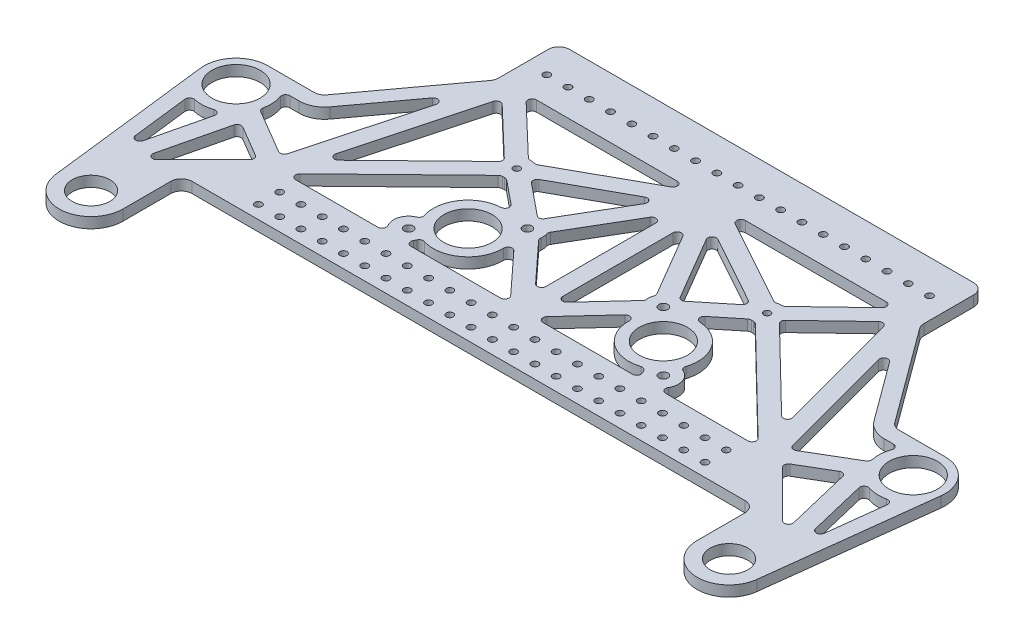
from build123d import *

# Parameters (mm, degrees)
SKETCH1_R            = 1.9939
SKETCH1_R_2          = 11.2395
SKETCH1_R_3          = 14.4145
SKETCH1_R_4          = 2.667
BOSS_EXTRUDE1_DEPTH  = 3.175
SKETCH2_R            = 2.0828
CUT_EXTRUDE1_DEPTH   = 310.212719881
SKETCH7_R            = 2.0828
CUT_EXTRUDE13_DEPTH  = 6.35
FILLET2_R            = 6.35
CUT_EXTRUDE14_START  = -6.35
CUT_EXTRUDE14_DEPTH  = 6.35
FILLET3_R            = 2.54
FILLET4_R            = 2.54
FILLET4_OF_MIRROR1_R = 2.54
FILLET5_START        = -3.175
FILLET5_DEPTH        = 6.35


with BuildPart() as part:
    # Sketch1 → Boss-Extrude1 (new, symmetric)
    with BuildSketch(Plane(origin=(0, 0, 0), x_dir=(1, 0, 0), z_dir=(0, 1, 0))):
        with BuildLine():
            Line((-127, 215.9), (127, 215.9))
            Line((127, 215.9), (127, 177.8))
            Line((127, 177.8), (171.45, 117.354106062))
            Line((171.45, 117.354106062), (202.217651581, 117.354106062))
            ThreePointArc((202.217651581, 117.354106062), (216.462925903, 110.952214992), (221.133744112, 96.049345906))
            Line((221.133744112, 96.049345906), (209.416092531, -2.254760156))
            ThreePointArc((209.416092531, -2.254760156), (189.370633521, -19.016493666), (171.45, 0))
            Line((171.45, 0), (171.45, 34.925))
            Line((171.45, 34.925), (-171.45, 34.925))
            Line((-171.45, 34.925), (-171.45, 0))
            ThreePointArc((-171.45, 0), (-189.370633521, -19.016493666), (-209.416092531, -2.254760156))
            Line((-209.416092531, -2.254760156), (-221.133744112, 96.049345906))
            ThreePointArc((-221.133744112, 96.049345906), (-216.462925903, 110.952214992), (-202.217651581, 117.354106062))
            Line((-202.217651581, 117.354106062), (-171.45, 117.354106062))
            Line((-171.45, 117.354106062), (-127, 177.8))
            Line((-127, 177.8), (-127, 215.9))
        make_face()
        with Locations(Location((-74.76671991, 138.48842, 0), (0, 0, 270))):
            Circle(SKETCH1_R, mode=Mode.SUBTRACT)
        with Locations(Location((-190.5, 0, 0), (0, 0, 270))):
            Circle(SKETCH1_R_2, mode=Mode.SUBTRACT)
        with Locations(Location((74.76671991, 138.48842, 0), (0, 0, 270))):
            Circle(SKETCH1_R, mode=Mode.SUBTRACT)
        with Locations(Location((190.5, 0, 0), (0, 0, 270))):
            Circle(SKETCH1_R_2, mode=Mode.SUBTRACT)
        with Locations(Location((-202.217651581, 98.304106062, 0), (0, 0, 270))):
            Circle(SKETCH1_R_3, mode=Mode.SUBTRACT)
        with Locations(Location((-76.045897469, 75.2348, 0), (0, 0, 270))):
            Circle(SKETCH1_R_4, mode=Mode.SUBTRACT)
        with Locations(Location((-40.587497469, 110.6932, 0), (0, 0, 270))):
            Circle(SKETCH1_R_4, mode=Mode.SUBTRACT)
        with Locations(Location((40.587497469, 110.6932, 0), (0, 0, 270))):
            Circle(SKETCH1_R_4, mode=Mode.SUBTRACT)
        with Locations(Location((76.045897469, 75.2348, 0), (0, 0, 270))):
            Circle(SKETCH1_R_4, mode=Mode.SUBTRACT)
        with Locations(Location((202.217651581, 98.304106062, 0), (0, 0, 270))):
            Circle(SKETCH1_R_3, mode=Mode.SUBTRACT)
        with Locations(Location((-58.316697469, 92.964, 0), (0, 0, 270))):
            Circle(SKETCH1_R_3, mode=Mode.SUBTRACT)
        with Locations(Location((58.316697469, 92.964, 0), (0, 0, 270))):
            Circle(SKETCH1_R_3, mode=Mode.SUBTRACT)
    extrude(amount=BOSS_EXTRUDE1_DEPTH, both=True)

    # Sketch2 → Cut-Extrude1 (cut, through all)
    with BuildSketch(Plane(origin=(0, 3.175, 0), x_dir=(1, 0, 0), z_dir=(0, 1, 0))):
        with Locations(Location((25.4, 195.904866, 0), (0, 0, 270))):
            Circle(SKETCH2_R)
        with Locations(Location((38.1, 195.904866, 0), (0, 0, 270))):
            Circle(SKETCH2_R)
        with Locations(Location((50.8, 195.904866, 0), (0, 0, 270))):
            Circle(SKETCH2_R)
        with Locations(Location((63.5, 195.904866, 0), (0, 0, 270))):
            Circle(SKETCH2_R)
        with Locations(Location((76.2, 195.904866, 0), (0, 0, 270))):
            Circle(SKETCH2_R)
        with Locations(Location((88.9, 195.904866, 0), (0, 0, 270))):
            Circle(SKETCH2_R)
        with Locations(Location((101.6, 195.904866, 0), (0, 0, 270))):
            Circle(SKETCH2_R)
        with Locations(Location((114.3, 195.904866, 0), (0, 0, 270))):
            Circle(SKETCH2_R)
        with Locations(Location((12.7, 195.904866, 0), (0, 0, 270))):
            Circle(SKETCH2_R)
        with Locations(Location((-12.7, 195.904866, 0), (0, 0, 90))):
            Circle(SKETCH2_R)
        with Locations(Location((-114.3, 195.904866, 0), (0, 0, 90))):
            Circle(SKETCH2_R)
        with Locations(Location((-101.6, 195.904866, 0), (0, 0, 90))):
            Circle(SKETCH2_R)
        with Locations(Location((-88.9, 195.904866, 0), (0, 0, 90))):
            Circle(SKETCH2_R)
        with Locations(Location((-76.2, 195.904866, 0), (0, 0, 90))):
            Circle(SKETCH2_R)
        with Locations(Location((-63.5, 195.904866, 0), (0, 0, 90))):
            Circle(SKETCH2_R)
        with Locations(Location((-50.8, 195.904866, 0), (0, 0, 90))):
            Circle(SKETCH2_R)
        with Locations(Location((-38.1, 195.904866, 0), (0, 0, 90))):
            Circle(SKETCH2_R)
        with Locations(Location((-25.4, 195.904866, 0), (0, 0, 90))):
            Circle(SKETCH2_R)
        with Locations(Location((0, 195.904866, 0), (0, 0, 270))):
            Circle(SKETCH2_R)
    extrude(amount=-CUT_EXTRUDE1_DEPTH, mode=Mode.SUBTRACT)

    # Sketch7 → Cut-Extrude13 (cut)
    with BuildSketch(Plane.XZ.offset(3.175)):
        with Locations(Location((133.35, -42.799, 0), (0, 0, 270))):
            Circle(SKETCH7_R)
        with Locations(Location((-95.25, -55.499, 0), (0, 0, 270))):
            Circle(SKETCH7_R)
        with Locations(Location((-107.95, -42.799, 0), (0, 0, 270))):
            Circle(SKETCH7_R)
        with Locations(Location((-107.95, -55.499, 0), (0, 0, 270))):
            Circle(SKETCH7_R)
        with Locations(Location((-120.65, -42.799, 0), (0, 0, 270))):
            Circle(SKETCH7_R)
        with Locations(Location((-69.85, -55.499, 0), (0, 0, 270))):
            Circle(SKETCH7_R)
        with Locations(Location((-82.55, -42.799, 0), (0, 0, 270))):
            Circle(SKETCH7_R)
        with Locations(Location((-82.55, -55.499, 0), (0, 0, 270))):
            Circle(SKETCH7_R)
        with Locations(Location((-95.25, -42.799, 0), (0, 0, 270))):
            Circle(SKETCH7_R)
        with Locations(Location((-120.65, -55.499, 0), (0, 0, 270))):
            Circle(SKETCH7_R)
        with Locations(Location((-133.35, -42.799, 0), (0, 0, 270))):
            Circle(SKETCH7_R)
        with Locations(Location((-133.35, -55.499, 0), (0, 0, 270))):
            Circle(SKETCH7_R)
        with Locations(Location((57.15, -42.799, 0), (0, 0, 270))):
            Circle(SKETCH7_R)
        with Locations(Location((69.85, -55.499, 0), (0, 0, 270))):
            Circle(SKETCH7_R)
        with Locations(Location((69.85, -42.799, 0), (0, 0, 270))):
            Circle(SKETCH7_R)
        with Locations(Location((82.55, -55.499, 0), (0, 0, 270))):
            Circle(SKETCH7_R)
        with Locations(Location((31.75, -42.799, 0), (0, 0, 270))):
            Circle(SKETCH7_R)
        with Locations(Location((44.45, -55.499, 0), (0, 0, 270))):
            Circle(SKETCH7_R)
        with Locations(Location((44.45, -42.799, 0), (0, 0, 270))):
            Circle(SKETCH7_R)
        with Locations(Location((57.15, -55.499, 0), (0, 0, 270))):
            Circle(SKETCH7_R)
        with Locations(Location((107.95, -42.799, 0), (0, 0, 270))):
            Circle(SKETCH7_R)
        with Locations(Location((120.65, -55.499, 0), (0, 0, 270))):
            Circle(SKETCH7_R)
        with Locations(Location((120.65, -42.799, 0), (0, 0, 270))):
            Circle(SKETCH7_R)
        with Locations(Location((133.35, -55.499, 0), (0, 0, 270))):
            Circle(SKETCH7_R)
        with Locations(Location((82.55, -42.799, 0), (0, 0, 270))):
            Circle(SKETCH7_R)
        with Locations(Location((95.25, -55.499, 0), (0, 0, 270))):
            Circle(SKETCH7_R)
        with Locations(Location((95.25, -42.799, 0), (0, 0, 270))):
            Circle(SKETCH7_R)
        with Locations(Location((107.95, -55.499, 0), (0, 0, 270))):
            Circle(SKETCH7_R)
        with Locations(Location((-44.45, -42.799, 0), (0, 0, 270))):
            Circle(SKETCH7_R)
        with Locations(Location((-31.75, -55.499, 0), (0, 0, 270))):
            Circle(SKETCH7_R)
        with Locations(Location((-31.75, -42.799, 0), (0, 0, 270))):
            Circle(SKETCH7_R)
        with Locations(Location((-19.05, -55.499, 0), (0, 0, 270))):
            Circle(SKETCH7_R)
        with Locations(Location((-69.85, -42.799, 0), (0, 0, 270))):
            Circle(SKETCH7_R)
        with Locations(Location((-57.15, -55.499, 0), (0, 0, 270))):
            Circle(SKETCH7_R)
        with Locations(Location((-57.15, -42.799, 0), (0, 0, 270))):
            Circle(SKETCH7_R)
        with Locations(Location((-44.45, -55.499, 0), (0, 0, 270))):
            Circle(SKETCH7_R)
        with Locations(Location((6.35, -42.799, 0), (0, 0, 270))):
            Circle(SKETCH7_R)
        with Locations(Location((19.05, -55.499, 0), (0, 0, 270))):
            Circle(SKETCH7_R)
        with Locations(Location((19.05, -42.799, 0), (0, 0, 270))):
            Circle(SKETCH7_R)
        with Locations(Location((31.75, -55.499, 0), (0, 0, 270))):
            Circle(SKETCH7_R)
        with Locations(Location((-19.05, -42.799, 0), (0, 0, 270))):
            Circle(SKETCH7_R)
        with Locations(Location((-6.35, -55.499, 0), (0, 0, 270))):
            Circle(SKETCH7_R)
        with Locations(Location((-6.35, -42.799, 0), (0, 0, 270))):
            Circle(SKETCH7_R)
        with Locations(Location((6.35, -55.499, 0), (0, 0, 270))):
            Circle(SKETCH7_R)
    extrude(amount=-CUT_EXTRUDE13_DEPTH, mode=Mode.SUBTRACT)

    # Fillet2
    fillet2_edges = [part.edges().sort_by_distance(p)[0] for p in [
        (171.45, 0, -34.925),
        (-171.45, 0, -34.925),
        (-171.45, 0, -117.354106062),
        (-127, 0, -177.8),
        (-127, 0, -215.9),
        (127, 0, -215.9),
        (127, 0, -177.8),
        (171.45, 0, -117.354106062),
    ]]
    fillet(fillet2_edges, radius=FILLET2_R)

    # Cut-Extrude14: read off the stored shape, not the designer's step
    # Cut-Extrude14 outline → Cut-Extrude14 (cut)
    with BuildSketch(Plane(origin=(0, 3.175, 0), x_dir=(1, 0, 0), z_dir=(0, 1, 0)).offset(CUT_EXTRUDE14_START)):
        with BuildLine():
            ThreePointArc((-191.259096018, 80.666801273), (-200.5240125, 77.60879145), (-210.162841238, 79.119778564))
            Line((-210.162841238, 79.119778564), (-204.019934013, 27.584451775))
            Line((-204.019934013, 27.584451775), (-191.259096018, 80.666801273))
        make_face()
        with BuildLine():
            ThreePointArc((-184.108569323, 108.464106062), (-181.585424546, 100.644120554), (-182.293194572, 92.457699206))
            Line((-182.293194572, 92.457699206), (-151.72468264, 74.441225873))
            Line((-151.72468264, 74.441225873), (-128.52280805, 160.723179985))
            Line((-128.52280805, 160.723179985), (-162.384828565, 114.675483683))
            ThreePointArc((-162.384828565, 114.675483683), (-167.782783829, 110.105322935), (-174.662514745, 108.464106062))
            Line((-174.662514745, 108.464106062), (-184.108569323, 108.464106062))
        make_face()
        with BuildLine():
            ThreePointArc((-39.272123059, 101.772657463), (-39.385427432, 101.756684089), (-39.498925379, 101.742149793))
            ThreePointArc((-39.498925379, 101.742149793), (-43.633978712, 78.281281241), (-67.094847263, 74.146227909))
            ThreePointArc((-67.094847263, 74.146227909), (-69.068691676, 69.522979946), (-73.211093603, 66.675))
            Line((-73.211093603, 66.675), (-6.909916439, 66.675))
            Line((-6.909916439, 66.675), (-39.272123059, 101.772657463))
        make_face()
        with BuildLine():
            ThreePointArc((-32.43632141, 114.548665971), (-31.6222383, 111.657781272), (-31.802741851, 108.659887992))
            Line((-31.802741851, 108.659887992), (-5.08, 79.678377215))
            Line((-5.08, 79.678377215), (-5.08, 161.183488616))
            Line((-5.08, 161.183488616), (-32.43632141, 114.548665971))
        make_face()
        with BuildLine():
            ThreePointArc((-43.162255097, 119.33478042), (-42.190861956, 119.566503293), (-41.199802002, 119.689386534))
            Line((-41.199802002, 119.689386534), (-13.766953585, 166.454666172))
            Line((-13.766953585, 166.454666172), (-65.728320974, 137.68595171))
            Line((-65.728320974, 137.68595171), (-43.162255097, 119.33478042))
        make_face()
        with BuildLine():
            Line((-75.96708436, 130.23131443), (-141.26907846, 66.675))
            Line((-141.26907846, 66.675), (-78.880701336, 66.675))
            ThreePointArc((-78.880701336, 66.675), (-85.018393692, 76.129562837), (-77.13446956, 84.185850207))
            ThreePointArc((-77.13446956, 84.185850207), (-73.36056899, 107.276455761), (-50.486550734, 112.19556942))
            Line((-50.486550734, 112.19556942), (-72.836367838, 130.37088293))
            ThreePointArc((-72.836367838, 130.37088293), (-74.395114846, 130.152799034), (-75.96708436, 130.23131443))
        make_face()
        with BuildLine():
            ThreePointArc((-76.044983874, 146.733825293), (-73.698448589, 146.763651936), (-71.436415448, 146.138893149))
            Line((-71.436415448, 146.138893149), (-10.487798064, 179.883451048))
            Line((-10.487798064, 179.883451048), (-110.754790282, 179.883451048))
            Line((-110.754790282, 179.883451048), (-76.044983874, 146.733825293))
        make_face()
        with BuildLine():
            ThreePointArc((-83.053312583, 137.512177673), (-83.110526949, 138.449033356), (-83.062159723, 139.386387434))
            Line((-83.062159723, 139.386387434), (-115.427439153, 170.296870998))
            Line((-115.427439153, 170.296870998), (-138.845326815, 83.211618432))
            Line((-138.845326815, 83.211618432), (-83.053312583, 137.512177673))
        make_face()
        Polygon((-156.782789951, 65.629029636), (-180.994268973, 79.898794128), (-193.153773173, 29.317864259), (-179.464477122, 42.947342466), align=None)
    cut_extrude14 = extrude(amount=CUT_EXTRUDE14_DEPTH, mode=Mode.SUBTRACT)

    # Fillet3
    # the kernel refuses this fillet: 2.54 mm, written as the material it adds along each edge
    with BuildSketch(Plane(origin=(-39.498925379, -3.175, -101.742149793), x_dir=(0.2258482453894221, 0, 0.9741624967399019), z_dir=(0, 1, 0))) as fillet3_piece_1:
        with BuildLine():
            CenterArc((9.128930143, 2.484904902), FILLET3_R, 119.625204819, 138.419359248)
            Line((7.873346381, 4.692869896), (7.747788004, 4.913666396))
            ThreePointArc((7.747788004, 4.913666396), (-0.104054898, 0.448628917), (-0.252552944, 0.027074166))
            Line((-0.252552944, 0.027074166), (0.052616312, -0.24849049))
            ThreePointArc((0.052616312, -0.24849049), (4.301383511, 0.196402429), (8.55015071, -0.24849049))
            Line((8.55015071, -0.24849049), (8.602767022, 0))
        make_face()
    extrude(amount=6.35)

    # Fillet4
    # the kernel refuses this fillet: 2.54 mm, written as the material it adds along each edge
    with BuildSketch(Plane(origin=(-83.062159723, -3.175, -139.386387434), x_dir=(-0.04732152733120442, 0, 0.9988797089995582), z_dir=(0, 1, 0))) as fillet4_piece_1:
        with BuildLine():
            CenterArc((1.162366176, -2.53535455), FILLET4_R, 93.4657791, 45.563633514)
            Line((-0.755451341, -0.869948903), (0, 0))
            ThreePointArc((0, 0), (0.504408571, -0.015260303), (1.008817143, 0))
        make_face()
    extrude(amount=6.35)
    with BuildSketch(Plane(origin=(-83.053312583, -3.175, -137.512177673), x_dir=(-0.7166203979765482, 0, 0.6974634077884899), z_dir=(0, 1, 0))) as fillet4_piece_2:
        with BuildLine():
            CenterArc((1.152179596, -2.54), FILLET4_R, 90, 45.563633498)
            ThreePointArc((-0.661452664, -0.761703617), (-0.319204097, -0.390857555), (0, 0))
            Line((0, 0), (1.152179596, 0))
        make_face()
    extrude(amount=6.35)
    with BuildSketch(Plane(origin=(-138.845326815, -3.175, -83.211618432), x_dir=(0.7166203979765504, 0, -0.697463407788488), z_dir=(0, 1, 0))) as fillet4_piece_3:
        with BuildLine():
            CenterArc((FILLET4_R * 3.63978872933, FILLET4_R), FILLET4_R, 120.724931699, 149.275068301)
            Line((FILLET4_R * 3.12887170345, FILLET4_R * 1.85963003243), (0, 0))
            Line((0, 0), (FILLET4_R * 3.63978872933, 0))
        make_face()
    extrude(amount=6.35)
    with BuildSketch(Plane(origin=(-115.427439153, -3.175, -170.296870998), x_dir=(-0.25968248598533045, 0, 0.9656940542803806), z_dir=(0, 1, 0))) as fillet4_piece_4:
        with BuildLine():
            CenterArc((FILLET4_R * 1.68525379622, FILLET4_R), FILLET4_R, 151.368298701, 118.631701299)
            Line((FILLET4_R * 0.807535811571, FILLET4_R * 1.47917756565), (0, 0))
            Line((0, 0), (FILLET4_R * 1.68525379622, 0))
        make_face()
    extrude(amount=6.35)
    with BuildSketch(Plane(origin=(-77.13446956, -3.175, -84.185850207), x_dir=(-0.3638938882978765, 0, -0.9314404103642124), z_dir=(0, 1, 0))) as fillet4_piece_5:
        with BuildLine():
            CenterArc((2.81982852, 2.534794914), FILLET4_R, 181.445326083, 84.886001486)
            ThreePointArc((0.280636623, 2.470728433), (0.225896023, 1.225643909), (0, 0))
            ThreePointArc((0, 0), (1.32865119, 0.042551581), (2.65730238, 0))
        make_face()
    extrude(amount=6.35)
    with BuildSketch(Plane(origin=(-78.880701336, -3.175, -66.675), x_dir=(-1, 0, 0), z_dir=(0, 1, 0))) as fillet4_piece_6:
        with BuildLine():
            CenterArc((7.030603219, -2.54), FILLET4_R, 90, 121.391239679)
            ThreePointArc((4.862381881, -3.863032967), (2.7742475, -1.499712765), (0, 0))
            Line((0, 0), (7.030603219, 0))
        make_face()
    extrude(amount=6.35)
    with BuildSketch(Plane(origin=(-141.26907846, -3.175, -66.675), x_dir=(0.716620397973644, 0, -0.6974634077914742), z_dir=(0, 1, 0))) as fillet4_piece_7:
        with BuildLine():
            CenterArc((FILLET4_R * 2.46123363433, -FILLET4_R), FILLET4_R, 90, 135.776154525)
            Line((FILLET4_R * 1.76377022654, -FILLET4_R * 1.71662039797), (0, 0))
            Line((0, 0), (FILLET4_R * 2.46123363433, 0))
        make_face()
    extrude(amount=6.35)
    with BuildSketch(Plane(origin=(-75.96708436, -3.175, -130.23131443), x_dir=(0.9964847240110659, 0, 0.08377466689035494), z_dir=(0, 1, 0))) as fillet4_piece_8:
        with BuildLine():
            CenterArc((1.162366176, -2.53535455), FILLET4_R, 93.465779089, 45.563633514)
            Line((-0.755451341, -0.869948902), (0, 0))
            ThreePointArc((0, 0), (0.504408572, -0.015260303), (1.008817143, 0))
        make_face()
    extrude(amount=6.35)
    with BuildSketch(Plane(origin=(-72.836367838, -3.175, -130.37088293), x_dir=(-0.985077138170045, 0, 0.17211342729349766), z_dir=(0, 1, 0))) as fillet4_piece_9:
        with BuildLine():
            CenterArc((1.162366176, 2.53535455), FILLET4_R, 220.970587389, 45.563633522)
            Line((-0.755451341, 0.869948903), (0, 0))
            ThreePointArc((0, 0), (0.504408572, 0.015260303), (1.008817143, 0))
        make_face()
    extrude(amount=6.35)
    with BuildSketch(Plane(origin=(-50.486550734, -3.175, -112.19556942), x_dir=(-0.7758406200304794, 0, -0.630928943947511), z_dir=(0, 1, 0))) as fillet4_piece_10:
        with BuildLine():
            CenterArc((9.532413351, 2.54), FILLET4_R, 131.991620614, 138.008379386)
            ThreePointArc((7.833097685, 4.427836398), (4.159272934, 1.784525297), (0, 0))
            Line((0, 0), (9.532413351, 0))
        make_face()
    extrude(amount=6.35)
    with BuildSketch(Plane(origin=(-180.994268973, -3.175, -79.898794128), x_dir=(0.8615028843672974, 0, 0.5077526762379762), z_dir=(0, 1, 0))) as fillet4_piece_11:
        with BuildLine():
            CenterArc((FILLET4_R * 1.35134876474, -FILLET4_R), FILLET4_R, 90, 106.99701288)
            Line((FILLET4_R * 0.395028767259, -FILLET4_R * 1.2923218473), (0, 0))
            Line((0, 0), (FILLET4_R * 1.35134876474, 0))
        make_face()
    extrude(amount=6.35)
    with BuildSketch(Plane(origin=(-156.782789951, -3.175, -65.629029636), x_dir=(-0.707106781202138, 0, 0.707106781170957), z_dir=(0, 1, 0))) as fillet4_piece_12:
        with BuildLine():
            CenterArc((FILLET4_R * 1.29118611705, -FILLET4_R), FILLET4_R, 90, 104.485747761)
            Line((FILLET4_R * 0.322976224971, -FILLET4_R * 1.25013917104), (0, 0))
            Line((0, 0), (FILLET4_R * 1.29118611705, 0))
        make_face()
    extrude(amount=6.35)
    with BuildSketch(Plane(origin=(-193.153773173, -3.175, -29.317864259), x_dir=(0.7086533803705231, 0, -0.705556791824323), z_dir=(0, 1, 0))) as fillet4_piece_13:
        with BuildLine():
            CenterArc((FILLET4_R * 3.53295813786, FILLET4_R), FILLET4_R, 121.608216653, 148.391783347)
            Line((FILLET4_R * 3.00885009312, FILLET4_R * 1.8516517818), (0, 0))
            Line((0, 0), (FILLET4_R * 3.53295813786, 0))
        make_face()
    extrude(amount=6.35)
    with BuildSketch(Plane(origin=(-128.52280805, -3.175, -160.723179985), x_dir=(-0.5924292899367688, 0, 0.8056224527810878), z_dir=(0, 1, 0))) as fillet4_piece_14:
        with BuildLine():
            CenterArc((FILLET4_R * 5.3233163656, FILLET4_R), FILLET4_R, 111.278365334, 158.721634666)
            Line((FILLET4_R * 4.96041696403, FILLET4_R * 1.93182832343), (0, 0))
            Line((0, 0), (FILLET4_R * 5.3233163656, 0))
        make_face()
    extrude(amount=6.35)
    with BuildSketch(Plane(origin=(-151.72468264, -3.175, -74.441225873), x_dir=(0.2596824859879843, 0, -0.9656940542796669), z_dir=(0, 1, 0))) as fillet4_piece_15:
        with BuildLine():
            CenterArc((FILLET4_R * 1.31418654711, FILLET4_R), FILLET4_R, 164.536970586, 105.463029414)
            Line((FILLET4_R * 0.350383856701, FILLET4_R * 1.2666165298), (0, 0))
            Line((0, 0), (FILLET4_R * 1.31418654711, 0))
        make_face()
    extrude(amount=6.35)
    with BuildSketch(Plane(origin=(-182.293194572, -3.175, -92.457699206), x_dir=(0.2400768424975751, 0, -0.9707538872939909), z_dir=(0, 1, 0))) as fillet4_piece_16:
        with BuildLine():
            CenterArc((1.893158688, -2.537655167), FILLET4_R, 92.462125159, 70.914698312)
            Line((-0.540686922, -1.811022148), (0, 0))
            ThreePointArc((0, 0), (0.892021457, -0.019169008), (1.784042914, 0))
        make_face()
    extrude(amount=6.35)
    with BuildSketch(Plane(origin=(-184.108569323, -3.175, -108.464106062), x_dir=(1, 0, 0), z_dir=(0, 1, 0))) as fillet4_piece_17:
        with BuildLine():
            CenterArc((3.914435178, -2.54), FILLET4_R, 90, 109.085301697)
            ThreePointArc((1.514051806, -3.370517711), (0.832146175, -1.65151449), (0, 0))
            Line((0, 0), (3.914435178, 0))
        make_face()
    extrude(amount=6.35)
    with BuildSketch(Plane(origin=(-41.199802002, -3.175, -119.689386534), x_dir=(-0.9917304978287779, 0, 0.12833791207700182), z_dir=(0, 1, 0))) as fillet4_piece_18:
        with BuildLine():
            CenterArc((1.248793481, -2.535316742), FILLET4_R, 93.479858275, 48.750392907)
            Line((-0.759021925, -0.979592701), (0, 0))
            ThreePointArc((0, 0), (0.547310723, -0.016625565), (1.094621445, 0))
        make_face()
    extrude(amount=6.35)
    with BuildSketch(Plane(origin=(-43.162255097, -3.175, -119.33478042), x_dir=(-0.7758406200501416, 0, -0.6309289439233327), z_dir=(0, 1, 0))) as fillet4_piece_19:
        with BuildLine():
            CenterArc((1.239240147, -2.54), FILLET4_R, 90, 48.750392898)
            ThreePointArc((-0.670444448, -0.865274725), (-0.322080072, -0.442820351), (0, 0))
            Line((0, 0), (1.239240147, 0))
        make_face()
    extrude(amount=6.35)
    with BuildSketch(Plane(origin=(-65.728320974, -3.175, -137.68595171), x_dir=(0.7758406200501409, 0, 0.6309289439233334), z_dir=(0, 1, 0))) as fillet4_piece_20:
        with BuildLine():
            CenterArc((FILLET4_R * 1.48005069013, FILLET4_R), FILLET4_R, 158.090054087, 111.909945913)
            Line((FILLET4_R * 0.552279196759, FILLET4_R * 1.37314883905), (0, 0))
            Line((0, 0), (FILLET4_R * 1.48005069013, 0))
        make_face()
    extrude(amount=6.35)
    with BuildSketch(Plane(origin=(-13.766953585, -3.175, -166.454666172), x_dir=(-0.8748619151761108, 0, 0.4843724077343668), z_dir=(0, 1, 0))) as fillet4_piece_21:
        with BuildLine():
            CenterArc((FILLET4_R * 3.65132209502, FILLET4_R), FILLET4_R, 120.632445885, 149.367554115)
            Line((FILLET4_R * 3.14179333344, FILLET4_R * 1.8604536252), (0, 0))
            Line((0, 0), (FILLET4_R * 3.65132209502, 0))
        make_face()
    extrude(amount=6.35)
    with BuildSketch(Plane(origin=(-31.802741851, -3.175, -108.659887992), x_dir=(0.6778770206187044, 0, 0.7351753157697207), z_dir=(0, 1, 0))) as fillet4_piece_22:
        with BuildLine():
            CenterArc((1.239240147, 2.54), FILLET4_R, 221.249607085, 48.750392915)
            ThreePointArc((-0.670444449, 0.865274726), (-0.322080073, 0.442820351), (0, 0))
            Line((0, 0), (1.239240147, 0))
        make_face()
    extrude(amount=6.35)
    with BuildSketch(Plane(origin=(-32.43632141, -3.175, -114.548665971), x_dir=(0.505976433417387, 0, -0.8625473023702646), z_dir=(0, 1, 0))) as fillet4_piece_23:
        with BuildLine():
            CenterArc((1.239240146, -2.54), FILLET4_R, 90, 48.750392908)
            ThreePointArc((-0.670444449, -0.865274725), (-0.322080073, -0.442820351), (0, 0))
            Line((0, 0), (1.239240146, 0))
        make_face()
    extrude(amount=6.35)
    with BuildSketch(Plane(origin=(-5.08, -3.175, -161.183488616), x_dir=(0, 0, 1), z_dir=(0, 1, 0))) as fillet4_piece_24:
        with BuildLine():
            CenterArc((FILLET4_R * 3.6810949668, -FILLET4_R), FILLET4_R, 90, 149.603808338)
            Line((FILLET4_R * 3.17511853338, -FILLET4_R * 1.86254730237), (0, 0))
            Line((0, 0), (FILLET4_R * 3.6810949668, 0))
        make_face()
    extrude(amount=6.35)
    with BuildSketch(Plane(origin=(-5.08, -3.175, -79.678377215), x_dir=(0, 0, -1), z_dir=(0, 1, 0))) as fillet4_piece_25:
        with BuildLine():
            CenterArc((FILLET4_R * 2.5597199241, FILLET4_R), FILLET4_R, 132.677967866, 137.322032134)
            Line((FILLET4_R * 1.88184290348, FILLET4_R * 1.73517531577), (0, 0))
            Line((0, 0), (FILLET4_R * 2.5597199241, 0))
        make_face()
    extrude(amount=6.35)
    with BuildSketch(Plane(origin=(-71.436415448, -3.175, -146.138893149), x_dir=(-0.9393456154245149, 0, -0.3429720320707496), z_dir=(0, 1, 0))) as fillet4_piece_26:
        with BuildLine():
            CenterArc((1.162366175, -2.53535455), FILLET4_R, 93.465779079, 45.5636335)
            Line((-0.755451341, -0.869948902), (0, 0))
            ThreePointArc((0, 0), (0.504408571, -0.015260303), (1.008817143, 0))
        make_face()
    extrude(amount=6.35)
    with BuildSketch(Plane(origin=(-76.044983874, -3.175, -146.733825293), x_dir=(-0.7231730176127877, 0, -0.6906669143638013), z_dir=(0, 1, 0))) as fillet4_piece_27:
        with BuildLine():
            CenterArc((1.152179596, -2.54), FILLET4_R, 90, 45.563633513)
            ThreePointArc((-0.661452665, -0.761703617), (-0.319204098, -0.390857555), (0, 0))
            Line((0, 0), (1.152179596, 0))
        make_face()
    extrude(amount=6.35)
    with BuildSketch(Plane(origin=(-110.754790282, -3.175, -179.883451048), x_dir=(0.7231730176127913, 0, 0.6906669143637977), z_dir=(0, 1, 0))) as fillet4_piece_28:
        with BuildLine():
            CenterArc((FILLET4_R * 2.49494073305, FILLET4_R), FILLET4_R, 133.682924128, 136.317075872)
            Line((FILLET4_R * 1.80427381868, FILLET4_R * 1.72317301761), (0, 0))
            Line((0, 0), (FILLET4_R * 2.49494073305, 0))
        make_face()
    extrude(amount=6.35)
    with BuildSketch(Plane(origin=(-10.487798064, -3.175, -179.883451048), x_dir=(-1, 0, 0), z_dir=(0, 1, 0))) as fillet4_piece_29:
        with BuildLine():
            CenterArc((FILLET4_R * 3.87070337873, FILLET4_R), FILLET4_R, 118.971362453, 151.028637547)
            Line((FILLET4_R * 3.386330971, FILLET4_R * 1.87486191518), (0, 0))
            Line((0, 0), (FILLET4_R * 3.87070337873, 0))
        make_face()
    extrude(amount=6.35)
    with BuildSketch(Plane(origin=(-6.909916439, -3.175, -66.675), x_dir=(-0.6778770206056016, 0, -0.7351753157818024), z_dir=(0, 1, 0))) as fillet4_piece_30:
        with BuildLine():
            CenterArc((FILLET4_R * 2.28228149747, FILLET4_R), FILLET4_R, 137.322032135, 132.677967865)
            Line((FILLET4_R * 1.54710618169, FILLET4_R * 1.67787702061), (0, 0))
            Line((0, 0), (FILLET4_R * 2.28228149747, 0))
        make_face()
    extrude(amount=6.35)
    with BuildSketch(Plane(origin=(-73.211093603, -3.175, -66.675), x_dir=(1, 0, 0), z_dir=(0, 1, 0))) as fillet4_piece_31:
        with BuildLine():
            CenterArc((7.03060322, 2.54), FILLET4_R, 148.608760327, 121.391239673)
            ThreePointArc((4.862381882, 3.863032967), (2.774247501, 1.499712765), (0, 0))
            Line((0, 0), (7.03060322, 0))
        make_face()
    extrude(amount=6.35)
    with BuildSketch(Plane(origin=(-67.094847263, -3.175, -74.146227909), x_dir=(0.9314404103532474, 0, 0.3638938883259433), z_dir=(0, 1, 0))) as fillet4_piece_32:
        with BuildLine():
            CenterArc((2.81982852, -2.534794914), FILLET4_R, 93.668672431, 84.886001494)
            ThreePointArc((0.280636624, -2.470728434), (0.225896023, -1.225643909), (0, 0))
            ThreePointArc((0, 0), (1.32865119, -0.042551581), (2.657302381, 0))
        make_face()
    extrude(amount=6.35)
    with BuildSketch(Plane(origin=(-210.162841238, -3.175, -79.119778564), x_dir=(0.11836011318265625, 0, 0.9929707365312378), z_dir=(0, 1, 0))) as fillet4_piece_33:
        with BuildLine():
            CenterArc((3.914435177, 2.54), FILLET4_R, 160.914698309, 109.085301691)
            ThreePointArc((1.514051805, 3.370517711), (0.832146175, 1.651514489), (0, 0))
            Line((0, 0), (3.914435177, 0))
        make_face()
    extrude(amount=6.35)
    with BuildSketch(Plane(origin=(-191.259096018, -3.175, -80.666801273), x_dir=(-0.23373792345864905, 0, 0.972299636499592), z_dir=(0, 1, 0))) as fillet4_piece_34:
        with BuildLine():
            CenterArc((5.245565583, -2.54), FILLET4_R, 90, 121.675881517)
            ThreePointArc((3.083943719, -3.873788184), (1.657852076, -1.844641225), (0, 0))
            Line((0, 0), (5.245565583, 0))
        make_face()
    extrude(amount=6.35)
    with BuildSketch(Plane(origin=(-204.019934013, -3.175, -27.584451775), x_dir=(0.2337379234586465, 0, -0.9722996364995926), z_dir=(0, 1, 0))) as fillet4_piece_35:
        with BuildLine():
            CenterArc((FILLET4_R * 5.58159991966, FILLET4_R), FILLET4_R, 110.314708853, 159.685291147)
            Line((FILLET4_R * 5.23442350663, FILLET4_R * 1.93779983911), (0, 0))
            Line((0, 0), (FILLET4_R * 5.58159991966, 0))
        make_face()
    extrude(amount=6.35)

    # Mirror1: Cut-Extrude14 across plane
    add(cut_extrude14.mirror(Plane(origin=(0, 0, 0), x_dir=(0, 0, 1), z_dir=(1, 0, 0))), mode=Mode.SUBTRACT)

    # Fillet4 of Mirror1
    # the kernel refuses this fillet: 2.54 mm, written as the material it adds along each edge
    with BuildSketch(Plane(origin=(83.062159723, -3.175, -139.386387434), x_dir=(0.04732152733120442, 0, 0.9988797089995582), z_dir=(0, 1, 0))) as fillet4_of_mirror1_piece_1:
        with BuildLine():
            CenterArc((1.162366176, 2.53535455), FILLET4_OF_MIRROR1_R, 220.970587385, 45.563633514)
            Line((-0.755451341, 0.869948903), (0, 0))
            ThreePointArc((0, 0), (0.504408571, 0.015260303), (1.008817143, 0))
        make_face()
    fillet4_of_mirror1_piece_1_solid = extrude(amount=6.35, mode=Mode.PRIVATE)
    with BuildSketch(Plane(origin=(83.053312583, -3.175, -137.512177673), x_dir=(0.056749560089853, 0, -0.9983884451603033), z_dir=(0, 1, 0))) as fillet4_of_mirror1_piece_2:
        with BuildLine():
            CenterArc((1.162366176, -2.53535455), FILLET4_OF_MIRROR1_R, 93.465779099, 45.563633498)
            Line((-0.755451341, -0.869948902), (0, 0))
            ThreePointArc((0, 0), (0.504408571, -0.015260303), (1.008817143, 0))
        make_face()
    fillet4_of_mirror1_piece_2_solid = extrude(amount=6.35, mode=Mode.PRIVATE)
    with BuildSketch(Plane(origin=(138.845326815, -3.175, -83.211618432), x_dir=(-0.2596824859853304, 0, -0.9656940542803806), z_dir=(0, 1, 0))) as fillet4_of_mirror1_piece_3:
        with BuildLine():
            CenterArc((FILLET4_OF_MIRROR1_R * 3.63978872933, FILLET4_OF_MIRROR1_R), FILLET4_OF_MIRROR1_R, 120.724931699, 149.275068301)
            Line((FILLET4_OF_MIRROR1_R * 3.12887170345, FILLET4_OF_MIRROR1_R * 1.85963003243), (0, 0))
            Line((0, 0), (FILLET4_OF_MIRROR1_R * 3.63978872933, 0))
        make_face()
    fillet4_of_mirror1_piece_3_solid = extrude(amount=6.35, mode=Mode.PRIVATE)
    with BuildSketch(Plane(origin=(115.427439153, -3.175, -170.296870998), x_dir=(-0.7231730176373539, 0, 0.6906669143380791), z_dir=(0, 1, 0))) as fillet4_of_mirror1_piece_4:
        with BuildLine():
            CenterArc((FILLET4_OF_MIRROR1_R * 1.68525379622, FILLET4_OF_MIRROR1_R), FILLET4_OF_MIRROR1_R, 151.368298701, 118.631701299)
            Line((FILLET4_OF_MIRROR1_R * 0.807535811571, FILLET4_OF_MIRROR1_R * 1.47917756565), (0, 0))
            Line((0, 0), (FILLET4_OF_MIRROR1_R * 1.68525379622, 0))
        make_face()
    fillet4_of_mirror1_piece_4_solid = extrude(amount=6.35, mode=Mode.PRIVATE)
    with BuildSketch(Plane(origin=(77.13446956, -3.175, -84.185850207), x_dir=(0.9665581194763087, 0, 0.2564476587423287), z_dir=(0, 1, 0))) as fillet4_of_mirror1_piece_5:
        with BuildLine():
            CenterArc((2.836842866, 2.515738597), FILLET4_OF_MIRROR1_R, 177.188528559, 84.886001486)
            ThreePointArc((0.29990017, 2.640324947), (0.192229805, 1.31536015), (0, 0))
            ThreePointArc((0, 0), (1.243307676, 0.086127981), (2.486615352, 0))
        make_face()
    fillet4_of_mirror1_piece_5_solid = extrude(amount=6.35, mode=Mode.PRIVATE)
    with BuildSketch(Plane(origin=(78.880701336, -3.175, -66.675), x_dir=(1, 0, 0), z_dir=(0, 1, 0))) as fillet4_of_mirror1_piece_6:
        with BuildLine():
            CenterArc((7.030603219, 2.54), FILLET4_OF_MIRROR1_R, 148.608760321, 121.391239679)
            ThreePointArc((4.862381881, 3.863032967), (2.7742475, 1.499712765), (0, 0))
            Line((0, 0), (7.030603219, 0))
        make_face()
    fillet4_of_mirror1_piece_6_solid = extrude(amount=6.35, mode=Mode.PRIVATE)
    with BuildSketch(Plane(origin=(141.26907846, -3.175, -66.675), x_dir=(-0.716620397973644, 0, -0.6974634077914742), z_dir=(0, 1, 0))) as fillet4_of_mirror1_piece_7:
        with BuildLine():
            CenterArc((FILLET4_OF_MIRROR1_R * 2.46123363433, FILLET4_OF_MIRROR1_R), FILLET4_OF_MIRROR1_R, 134.223845475, 135.776154525)
            Line((FILLET4_OF_MIRROR1_R * 1.76377022654, FILLET4_OF_MIRROR1_R * 1.71662039797), (0, 0))
            Line((0, 0), (FILLET4_OF_MIRROR1_R * 2.46123363433, 0))
        make_face()
    fillet4_of_mirror1_piece_7_solid = extrude(amount=6.35, mode=Mode.PRIVATE)
    with BuildSketch(Plane(origin=(75.96708436, -3.175, -130.23131443), x_dir=(0.716620397973642, 0, 0.6974634077914762), z_dir=(0, 1, 0))) as fillet4_of_mirror1_piece_8:
        with BuildLine():
            CenterArc((1.152179596, -2.54), FILLET4_OF_MIRROR1_R, 90, 45.563633514)
            ThreePointArc((-0.661452664, -0.761703618), (-0.319204097, -0.390857555), (0, 0))
            Line((0, 0), (1.152179596, 0))
        make_face()
    fillet4_of_mirror1_piece_8_solid = extrude(amount=6.35, mode=Mode.PRIVATE)
    with BuildSketch(Plane(origin=(72.836367838, -3.175, -130.37088293), x_dir=(-0.7758406200304763, 0, 0.6309289439475149), z_dir=(0, 1, 0))) as fillet4_of_mirror1_piece_9:
        with BuildLine():
            CenterArc((1.152179596, 2.54), FILLET4_OF_MIRROR1_R, 224.436366478, 45.563633522)
            ThreePointArc((-0.661452664, 0.761703618), (-0.319204097, 0.390857555), (0, 0))
            Line((0, 0), (1.152179596, 0))
        make_face()
    fillet4_of_mirror1_piece_9_solid = extrude(amount=6.35, mode=Mode.PRIVATE)
    with BuildSketch(Plane(origin=(50.486550734, -3.175, -112.19556942), x_dir=(0.9858782001739195, 0, -0.1674639496185163), z_dir=(0, 1, 0))) as fillet4_of_mirror1_piece_10:
        with BuildLine():
            CenterArc((9.5482863, 2.479663895), FILLET4_OF_MIRROR1_R, 119.478291301, 138.008379386)
            Line((8.298368157, 4.690841101), (0, 0))
            ThreePointArc((0, 0), (4.498976398, 0.493247655), (8.997952796, 0))
        make_face()
    fillet4_of_mirror1_piece_10_solid = extrude(amount=6.35, mode=Mode.PRIVATE)
    with BuildSketch(Plane(origin=(180.994268973, -3.175, -79.898794128), x_dir=(-0.8615028843672974, 0, 0.5077526762379762), z_dir=(0, 1, 0))) as fillet4_of_mirror1_piece_11:
        with BuildLine():
            CenterArc((FILLET4_OF_MIRROR1_R * 1.35134876474, FILLET4_OF_MIRROR1_R), FILLET4_OF_MIRROR1_R, 163.00298712, 106.99701288)
            Line((FILLET4_OF_MIRROR1_R * 0.395028767259, FILLET4_OF_MIRROR1_R * 1.2923218473), (0, 0))
            Line((0, 0), (FILLET4_OF_MIRROR1_R * 1.35134876474, 0))
        make_face()
    fillet4_of_mirror1_piece_11_solid = extrude(amount=6.35, mode=Mode.PRIVATE)
    with BuildSketch(Plane(origin=(156.782789951, -3.175, -65.629029636), x_dir=(0.8615028843672982, 0, -0.5077526762379749), z_dir=(0, 1, 0))) as fillet4_of_mirror1_piece_12:
        with BuildLine():
            CenterArc((FILLET4_OF_MIRROR1_R * 1.29118611705, -FILLET4_OF_MIRROR1_R), FILLET4_OF_MIRROR1_R, 90, 104.485747761)
            Line((FILLET4_OF_MIRROR1_R * 0.322976224971, -FILLET4_OF_MIRROR1_R * 1.25013917104), (0, 0))
            Line((0, 0), (FILLET4_OF_MIRROR1_R * 1.29118611705, 0))
        make_face()
    fillet4_of_mirror1_piece_12_solid = extrude(amount=6.35, mode=Mode.PRIVATE)
    with BuildSketch(Plane(origin=(193.153773173, -3.175, -29.317864259), x_dir=(-0.23373792344907376, 0, -0.972299636501894), z_dir=(0, 1, 0))) as fillet4_of_mirror1_piece_13:
        with BuildLine():
            CenterArc((FILLET4_OF_MIRROR1_R * 3.53295813786, FILLET4_OF_MIRROR1_R), FILLET4_OF_MIRROR1_R, 121.608216653, 148.391783347)
            Line((FILLET4_OF_MIRROR1_R * 3.00885009312, FILLET4_OF_MIRROR1_R * 1.8516517818), (0, 0))
            Line((0, 0), (FILLET4_OF_MIRROR1_R * 3.53295813786, 0))
        make_face()
    fillet4_of_mirror1_piece_13_solid = extrude(amount=6.35, mode=Mode.PRIVATE)
    with BuildSketch(Plane(origin=(128.52280805, -3.175, -160.723179985), x_dir=(0.2596824859879855, 0, 0.9656940542796666), z_dir=(0, 1, 0))) as fillet4_of_mirror1_piece_14:
        with BuildLine():
            CenterArc((FILLET4_OF_MIRROR1_R * 5.3233163656, FILLET4_OF_MIRROR1_R), FILLET4_OF_MIRROR1_R, 111.278365334, 158.721634666)
            Line((FILLET4_OF_MIRROR1_R * 4.96041696403, FILLET4_OF_MIRROR1_R * 1.93182832343), (0, 0))
            Line((0, 0), (FILLET4_OF_MIRROR1_R * 5.3233163656, 0))
        make_face()
    fillet4_of_mirror1_piece_14_solid = extrude(amount=6.35, mode=Mode.PRIVATE)
    with BuildSketch(Plane(origin=(151.72468264, -3.175, -74.441225873), x_dir=(0.8615028843612801, 0, -0.5077526762481857), z_dir=(0, 1, 0))) as fillet4_of_mirror1_piece_15:
        with BuildLine():
            CenterArc((FILLET4_OF_MIRROR1_R * 1.31418654711, FILLET4_OF_MIRROR1_R), FILLET4_OF_MIRROR1_R, 164.536970586, 105.463029414)
            Line((FILLET4_OF_MIRROR1_R * 0.350383856701, FILLET4_OF_MIRROR1_R * 1.2666165298), (0, 0))
            Line((0, 0), (FILLET4_OF_MIRROR1_R * 1.31418654711, 0))
        make_face()
    fillet4_of_mirror1_piece_15_solid = extrude(amount=6.35, mode=Mode.PRIVATE)
    with BuildSketch(Plane(origin=(182.293194572, -3.175, -92.457699206), x_dir=(-0.2400768424975751, 0, -0.9707538872939909), z_dir=(0, 1, 0))) as fillet4_of_mirror1_piece_16:
        with BuildLine():
            CenterArc((1.893158688, 2.537655167), FILLET4_OF_MIRROR1_R, 196.62317653, 70.914698312)
            Line((-0.540686922, 1.811022148), (0, 0))
            ThreePointArc((0, 0), (0.892021457, 0.019169008), (1.784042914, 0))
        make_face()
    fillet4_of_mirror1_piece_16_solid = extrude(amount=6.35, mode=Mode.PRIVATE)
    with BuildSketch(Plane(origin=(184.108569323, -3.175, -108.464106062), x_dir=(-1, 0, 0), z_dir=(0, 1, 0))) as fillet4_of_mirror1_piece_17:
        with BuildLine():
            CenterArc((3.914435178, 2.54), FILLET4_OF_MIRROR1_R, 160.914698303, 109.085301697)
            ThreePointArc((1.514051806, 3.370517711), (0.832146175, 1.65151449), (0, 0))
            Line((0, 0), (3.914435178, 0))
        make_face()
    fillet4_of_mirror1_piece_17_solid = extrude(amount=6.35, mode=Mode.PRIVATE)
    with BuildSketch(Plane(origin=(41.199802002, -3.175, -119.689386534), x_dir=(0.9917304978287794, 0, 0.12833791207698989), z_dir=(0, 1, 0))) as fillet4_of_mirror1_piece_18:
        with BuildLine():
            CenterArc((1.248793481, 2.535316742), FILLET4_OF_MIRROR1_R, 217.769748818, 48.750392907)
            Line((-0.759021925, 0.979592701), (0, 0))
            ThreePointArc((0, 0), (0.547310723, 0.016625565), (1.094621445, 0))
        make_face()
    fillet4_of_mirror1_piece_18_solid = extrude(amount=6.35, mode=Mode.PRIVATE)
    with BuildSketch(Plane(origin=(43.162255097, -3.175, -119.33478042), x_dir=(-0.9739302201015225, 0, -0.22684780442622715), z_dir=(0, 1, 0))) as fillet4_of_mirror1_piece_19:
        with BuildLine():
            CenterArc((1.248793481, -2.535316742), FILLET4_OF_MIRROR1_R, 93.479858275, 48.750392898)
            Line((-0.759021925, -0.979592701), (0, 0))
            ThreePointArc((0, 0), (0.547310723, -0.016625565), (1.094621445, 0))
        make_face()
    fillet4_of_mirror1_piece_19_solid = extrude(amount=6.35, mode=Mode.PRIVATE)
    with BuildSketch(Plane(origin=(65.728320974, -3.175, -137.68595171), x_dir=(-0.874861915176109, 0, -0.48437240773436985), z_dir=(0, 1, 0))) as fillet4_of_mirror1_piece_20:
        with BuildLine():
            CenterArc((FILLET4_OF_MIRROR1_R * 1.48005069013, FILLET4_OF_MIRROR1_R), FILLET4_OF_MIRROR1_R, 158.090054087, 111.909945913)
            Line((FILLET4_OF_MIRROR1_R * 0.552279196759, FILLET4_OF_MIRROR1_R * 1.37314883905), (0, 0))
            Line((0, 0), (FILLET4_OF_MIRROR1_R * 1.48005069013, 0))
        make_face()
    fillet4_of_mirror1_piece_20_solid = extrude(amount=6.35, mode=Mode.PRIVATE)
    with BuildSketch(Plane(origin=(13.766953585, -3.175, -166.454666172), x_dir=(0.5059764334080609, 0, 0.8625473023757354), z_dir=(0, 1, 0))) as fillet4_of_mirror1_piece_21:
        with BuildLine():
            CenterArc((FILLET4_OF_MIRROR1_R * 3.65132209502, FILLET4_OF_MIRROR1_R), FILLET4_OF_MIRROR1_R, 120.632445885, 149.367554115)
            Line((FILLET4_OF_MIRROR1_R * 3.14179333344, FILLET4_OF_MIRROR1_R * 1.8604536252), (0, 0))
            Line((0, 0), (FILLET4_OF_MIRROR1_R * 3.65132209502, 0))
        make_face()
    fillet4_of_mirror1_piece_21_solid = extrude(amount=6.35, mode=Mode.PRIVATE)
    with BuildSketch(Plane(origin=(31.802741851, -3.175, -108.659887992), x_dir=(-0.16594753798211512, 0, -0.9861345824164542), z_dir=(0, 1, 0))) as fillet4_of_mirror1_piece_22:
        with BuildLine():
            CenterArc((1.248793481, 2.535316742), FILLET4_OF_MIRROR1_R, 217.769748843, 48.750392915)
            Line((-0.759021925, 0.9795927), (0, 0))
            ThreePointArc((0, 0), (0.547310723, 0.016625565), (1.094621446, 0))
        make_face()
    fillet4_of_mirror1_piece_22_solid = extrude(amount=6.35, mode=Mode.PRIVATE)
    with BuildSketch(Plane(origin=(32.43632141, -3.175, -114.548665971), x_dir=(-0.505976433417387, 0, -0.8625473023702646), z_dir=(0, 1, 0))) as fillet4_of_mirror1_piece_23:
        with BuildLine():
            CenterArc((1.239240146, 2.54), FILLET4_OF_MIRROR1_R, 221.249607092, 48.750392908)
            ThreePointArc((-0.670444449, 0.865274725), (-0.322080073, 0.442820351), (0, 0))
            Line((0, 0), (1.239240146, 0))
        make_face()
    fillet4_of_mirror1_piece_23_solid = extrude(amount=6.35, mode=Mode.PRIVATE)
    with BuildSketch(Plane(origin=(5.08, -3.175, -161.183488616), x_dir=(0.505976433417385, 0, 0.8625473023702658), z_dir=(0, 1, 0))) as fillet4_of_mirror1_piece_24:
        with BuildLine():
            CenterArc((FILLET4_OF_MIRROR1_R * 3.6810949668, -FILLET4_OF_MIRROR1_R), FILLET4_OF_MIRROR1_R, 90, 149.603808338)
            Line((FILLET4_OF_MIRROR1_R * 3.17511853338, -FILLET4_OF_MIRROR1_R * 1.86254730237), (0, 0))
            Line((0, 0), (FILLET4_OF_MIRROR1_R * 3.6810949668, 0))
        make_face()
    fillet4_of_mirror1_piece_24_solid = extrude(amount=6.35, mode=Mode.PRIVATE)
    with BuildSketch(Plane(origin=(5.08, -3.175, -79.678377215), x_dir=(0.6778770206187047, 0, -0.7351753157697205), z_dir=(0, 1, 0))) as fillet4_of_mirror1_piece_25:
        with BuildLine():
            CenterArc((FILLET4_OF_MIRROR1_R * 2.5597199241, FILLET4_OF_MIRROR1_R), FILLET4_OF_MIRROR1_R, 132.677967866, 137.322032134)
            Line((FILLET4_OF_MIRROR1_R * 1.88184290348, FILLET4_OF_MIRROR1_R * 1.73517531577), (0, 0))
            Line((0, 0), (FILLET4_OF_MIRROR1_R * 2.5597199241, 0))
        make_face()
    fillet4_of_mirror1_piece_25_solid = extrude(amount=6.35, mode=Mode.PRIVATE)
    with BuildSketch(Plane(origin=(71.436415448, -3.175, -146.138893149), x_dir=(0.9393456154245149, 0, -0.3429720320707496), z_dir=(0, 1, 0))) as fillet4_of_mirror1_piece_26:
        with BuildLine():
            CenterArc((1.162366175, 2.53535455), FILLET4_OF_MIRROR1_R, 220.970587421, 45.5636335)
            Line((-0.755451341, 0.869948902), (0, 0))
            ThreePointArc((0, 0), (0.504408571, 0.015260303), (1.008817143, 0))
        make_face()
    fillet4_of_mirror1_piece_26_solid = extrude(amount=6.35, mode=Mode.PRIVATE)
    with BuildSketch(Plane(origin=(76.044983874, -3.175, -146.733825293), x_dir=(-0.9956494230856721, 0, -0.09317846483586402), z_dir=(0, 1, 0))) as fillet4_of_mirror1_piece_27:
        with BuildLine():
            CenterArc((1.162366176, -2.53535455), FILLET4_OF_MIRROR1_R, 93.46577908, 45.563633513)
            Line((-0.755451341, -0.869948902), (0, 0))
            ThreePointArc((0, 0), (0.504408572, -0.015260303), (1.008817143, 0))
        make_face()
    fillet4_of_mirror1_piece_27_solid = extrude(amount=6.35, mode=Mode.PRIVATE)
    with BuildSketch(Plane(origin=(110.754790282, -3.175, -179.883451048), x_dir=(-1, 0, 0), z_dir=(0, 1, 0))) as fillet4_of_mirror1_piece_28:
        with BuildLine():
            CenterArc((FILLET4_OF_MIRROR1_R * 2.49494073305, FILLET4_OF_MIRROR1_R), FILLET4_OF_MIRROR1_R, 133.682924128, 136.317075872)
            Line((FILLET4_OF_MIRROR1_R * 1.80427381868, FILLET4_OF_MIRROR1_R * 1.72317301761), (0, 0))
            Line((0, 0), (FILLET4_OF_MIRROR1_R * 2.49494073305, 0))
        make_face()
    fillet4_of_mirror1_piece_28_solid = extrude(amount=6.35, mode=Mode.PRIVATE)
    with BuildSketch(Plane(origin=(10.487798064, -3.175, -179.883451048), x_dir=(0.8748619151766566, 0, 0.4843724077333811), z_dir=(0, 1, 0))) as fillet4_of_mirror1_piece_29:
        with BuildLine():
            CenterArc((FILLET4_OF_MIRROR1_R * 3.87070337873, FILLET4_OF_MIRROR1_R), FILLET4_OF_MIRROR1_R, 118.971362453, 151.028637547)
            Line((FILLET4_OF_MIRROR1_R * 3.386330971, FILLET4_OF_MIRROR1_R * 1.87486191518), (0, 0))
            Line((0, 0), (FILLET4_OF_MIRROR1_R * 3.87070337873, 0))
        make_face()
    fillet4_of_mirror1_piece_29_solid = extrude(amount=6.35, mode=Mode.PRIVATE)
    with BuildSketch(Plane(origin=(6.909916439, -3.175, -66.675), x_dir=(1, 0, 0), z_dir=(0, 1, 0))) as fillet4_of_mirror1_piece_30:
        with BuildLine():
            CenterArc((FILLET4_OF_MIRROR1_R * 2.28228149747, FILLET4_OF_MIRROR1_R), FILLET4_OF_MIRROR1_R, 137.322032135, 132.677967865)
            Line((FILLET4_OF_MIRROR1_R * 1.54710618169, FILLET4_OF_MIRROR1_R * 1.67787702061), (0, 0))
            Line((0, 0), (FILLET4_OF_MIRROR1_R * 2.28228149747, 0))
        make_face()
    fillet4_of_mirror1_piece_30_solid = extrude(amount=6.35, mode=Mode.PRIVATE)
    with BuildSketch(Plane(origin=(73.211093603, -3.175, -66.675), x_dir=(-0.7829751841410316, 0, -0.6220529406885861), z_dir=(0, 1, 0))) as fillet4_of_mirror1_piece_31:
        with BuildLine():
            CenterArc((7.08480232, 2.38465044), FILLET4_OF_MIRROR1_R, 128.466206553, 121.391239673)
            Line((5.504787851, 4.373407408), (0, 0))
            ThreePointArc((0, 0), (3.105067683, 0.551490938), (6.210135366, 0))
        make_face()
    fillet4_of_mirror1_piece_31_solid = extrude(amount=6.35, mode=Mode.PRIVATE)
    with BuildSketch(Plane(origin=(67.094847263, -3.175, -74.146227909), x_dir=(-0.9314404103532474, 0, 0.3638938883259433), z_dir=(0, 1, 0))) as fillet4_of_mirror1_piece_32:
        with BuildLine():
            CenterArc((2.81982852, 2.534794914), FILLET4_OF_MIRROR1_R, 181.445326074, 84.886001494)
            ThreePointArc((0.280636624, 2.470728434), (0.225896023, 1.225643909), (0, 0))
            ThreePointArc((0, 0), (1.32865119, 0.042551581), (2.657302381, 0))
        make_face()
    fillet4_of_mirror1_piece_32_solid = extrude(amount=6.35, mode=Mode.PRIVATE)
    with BuildSketch(Plane(origin=(210.162841238, -3.175, -79.119778564), x_dir=(-0.9542801828483983, 0, 0.29891358721681976), z_dir=(0, 1, 0))) as fillet4_of_mirror1_piece_33:
        with BuildLine():
            CenterArc((3.92095332, 2.529926446), FILLET4_OF_MIRROR1_R, 155.810168164, 109.085301691)
            Line((1.603983481, 3.57071978), (0, 0))
            ThreePointArc((0, 0), (1.847480887, 0.082351305), (3.694961774, 0))
        make_face()
    fillet4_of_mirror1_piece_33_solid = extrude(amount=6.35, mode=Mode.PRIVATE)
    with BuildSketch(Plane(origin=(191.259096018, -3.175, -80.666801273), x_dir=(0.9062617039172085, 0, 0.42271707324530655), z_dir=(0, 1, 0))) as fillet4_of_mirror1_piece_34:
        with BuildLine():
            CenterArc((5.254300264, -2.521881642), FILLET4_OF_MIRROR1_R, 96.847604757, 121.675881517)
            Line((3.267123862, -4.103883521), (0, 0))
            ThreePointArc((0, 0), (2.475729375, -0.148117575), (4.95145875, 0))
        make_face()
    fillet4_of_mirror1_piece_34_solid = extrude(amount=6.35, mode=Mode.PRIVATE)
    with BuildSketch(Plane(origin=(204.019934013, -3.175, -27.584451775), x_dir=(0.1183601131826587, 0, -0.9929707365312376), z_dir=(0, 1, 0))) as fillet4_of_mirror1_piece_35:
        with BuildLine():
            CenterArc((FILLET4_OF_MIRROR1_R * 5.58159991966, FILLET4_OF_MIRROR1_R), FILLET4_OF_MIRROR1_R, 110.314708853, 159.685291147)
            Line((FILLET4_OF_MIRROR1_R * 5.23442350663, FILLET4_OF_MIRROR1_R * 1.93779983911), (0, 0))
            Line((0, 0), (FILLET4_OF_MIRROR1_R * 5.58159991966, 0))
        make_face()
    fillet4_of_mirror1_piece_35_solid = extrude(amount=6.35, mode=Mode.PRIVATE)
    add([fillet4_of_mirror1_piece_1_solid, fillet4_of_mirror1_piece_2_solid, fillet4_of_mirror1_piece_3_solid, fillet4_of_mirror1_piece_4_solid, fillet4_of_mirror1_piece_5_solid, fillet4_of_mirror1_piece_6_solid, fillet4_of_mirror1_piece_7_solid, fillet4_of_mirror1_piece_8_solid, fillet4_of_mirror1_piece_9_solid, fillet4_of_mirror1_piece_10_solid, fillet4_of_mirror1_piece_11_solid, fillet4_of_mirror1_piece_12_solid, fillet4_of_mirror1_piece_13_solid, fillet4_of_mirror1_piece_14_solid, fillet4_of_mirror1_piece_15_solid, fillet4_of_mirror1_piece_16_solid, fillet4_of_mirror1_piece_17_solid, fillet4_of_mirror1_piece_18_solid, fillet4_of_mirror1_piece_19_solid, fillet4_of_mirror1_piece_20_solid, fillet4_of_mirror1_piece_21_solid, fillet4_of_mirror1_piece_22_solid, fillet4_of_mirror1_piece_23_solid, fillet4_of_mirror1_piece_24_solid, fillet4_of_mirror1_piece_25_solid, fillet4_of_mirror1_piece_26_solid, fillet4_of_mirror1_piece_27_solid, fillet4_of_mirror1_piece_28_solid, fillet4_of_mirror1_piece_29_solid, fillet4_of_mirror1_piece_30_solid, fillet4_of_mirror1_piece_31_solid, fillet4_of_mirror1_piece_32_solid, fillet4_of_mirror1_piece_33_solid, fillet4_of_mirror1_piece_34_solid, fillet4_of_mirror1_piece_35_solid])

    # Fillet5: read off the stored shape, not the designer's step
    # Fillet5 outline → Fillet5 (add)
    with BuildSketch(Plane(origin=(0, 0, 0), x_dir=(1, 0, 0), z_dir=(0, 1, 0)).offset(FILLET5_START)):
        with BuildLine():
            ThreePointArc((33.149126058, 95.132107457), (35.963352219, 95.767208104), (37.556005541, 93.361656792))
            ThreePointArc((37.556005541, 93.361656792), (38.088700306, 97.653625891), (39.498925379, 101.742149793))
            ThreePointArc((39.498925379, 101.742149793), (39.385427432, 101.756684089), (39.272123059, 101.772657463))
            Line((39.272123059, 101.772657463), (33.149126058, 95.132107457))
        make_face()
    extrude(amount=FILLET5_DEPTH)


solid = part.part
